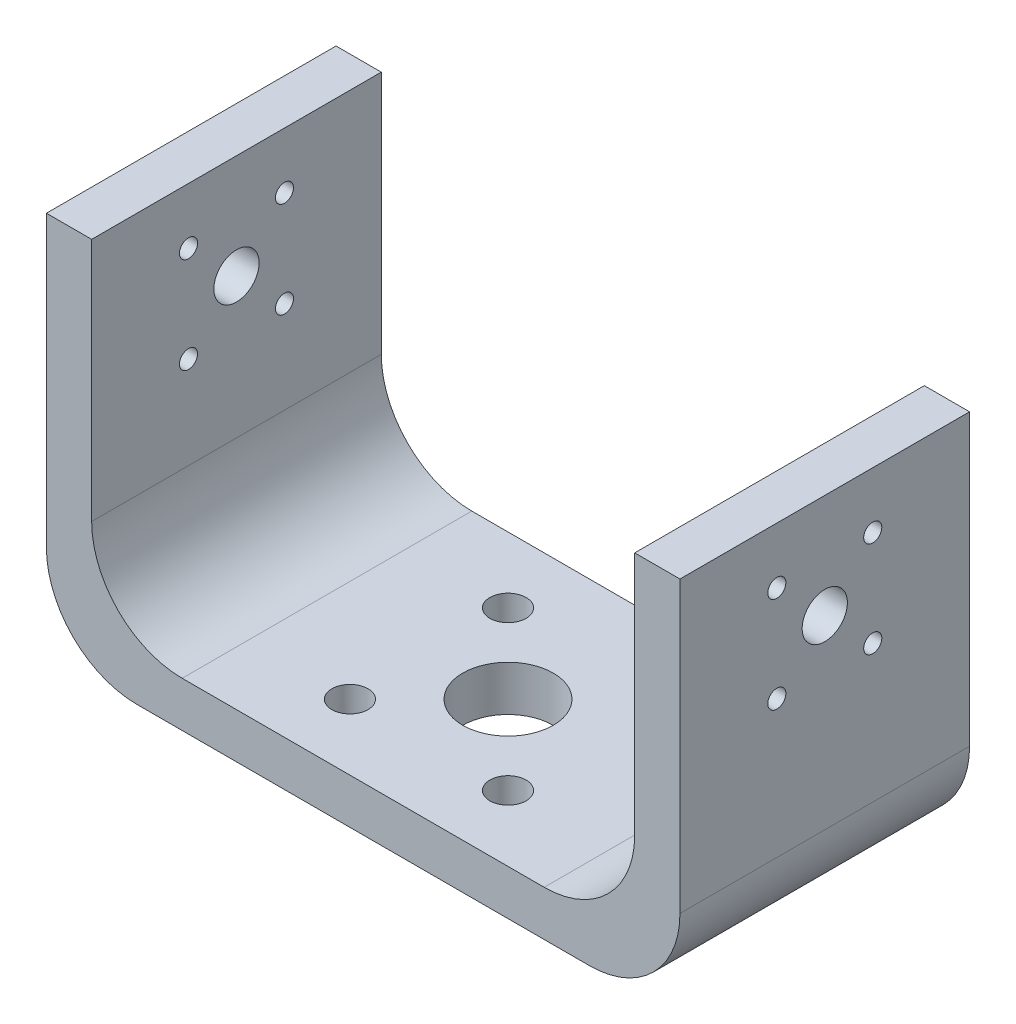
from build123d import *

# Parameters (mm, degrees)
SKETCH1_W           = 70
SKETCH1_H           = 32
BOSS_EXTRUDE1_DEPTH = 5
SKETCH2_W           = 5
SKETCH2_H           = 32
BOSS_EXTRUDE2_DEPTH = 37
SKETCH3_R           = 5
SKETCH3_R_2         = 2
CUT_EXTRUDE1_DEPTH  = 10
SKETCH4_R           = 2.5
CUT_EXTRUDE2_DEPTH  = 88.681240867
FILLET1_R           = 10
SKETCH6_R           = 1
CUT_EXTRUDE3_DEPTH  = 88.681240867


with BuildPart() as part:
    # Sketch1 → Boss-Extrude1 (new body)
    with BuildSketch(Plane(origin=(0, 0, 0), x_dir=(1, 0, 0), z_dir=(0, 1, 0))):
        with Locations((0, -16)):
            Rectangle(SKETCH1_W, SKETCH1_H)
    extrude(amount=BOSS_EXTRUDE1_DEPTH)

    # Sketch2 → Boss-Extrude2 (add)
    with BuildSketch(Plane(origin=(0, 5, 0), x_dir=(1, 0, 0), z_dir=(0, 1, 0))):
        with Locations((-32.5, -16)):
            Rectangle(SKETCH2_W, SKETCH2_H)
        with Locations((32.5, -16)):
            Rectangle(SKETCH2_W, SKETCH2_H)
    extrude(amount=BOSS_EXTRUDE2_DEPTH)

    # Sketch3 → Cut-Extrude1 (cut)
    with BuildSketch(Plane.XZ):
        with Locations((0, 16)):
            Circle(SKETCH3_R)
        with Locations((-8.732768748, 7.267231252)):
            Circle(SKETCH3_R_2)
        with Locations((-8.732768748, 24.732768748)):
            Circle(SKETCH3_R_2)
        with Locations((8.732768748, 24.732768748)):
            Circle(SKETCH3_R_2)
        with Locations((8.732768748, 7.267231252)):
            Circle(SKETCH3_R_2)
    extrude(amount=-CUT_EXTRUDE1_DEPTH, mode=Mode.SUBTRACT)

    # Sketch4 → Cut-Extrude2 (cut, through all)
    with BuildSketch(Plane.ZY.offset(35)):
        with Locations((16, 30.5)):
            Circle(SKETCH4_R)
    extrude(amount=-CUT_EXTRUDE2_DEPTH, mode=Mode.SUBTRACT)

    # Fillet1
    fillet1_edges = [part.edges().sort_by_distance(p)[0] for p in [
        (-35, 0, 16),
        (-30, 5, 16),
        (30, 5, 16),
        (35, 0, 16),
    ]]
    fillet(fillet1_edges, radius=FILLET1_R)

    # Sketch6 → Cut-Extrude3 (cut, through all)
    with BuildSketch(Plane.ZY.offset(35)):
        with Locations((21.3, 25.2)):
            Circle(SKETCH6_R)
        with Locations((10.7, 25.2)):
            Circle(SKETCH6_R)
        with Locations((10.7, 35.8)):
            Circle(SKETCH6_R)
        with Locations((21.3, 35.8)):
            Circle(SKETCH6_R)
    extrude(amount=-CUT_EXTRUDE3_DEPTH, mode=Mode.SUBTRACT)


solid = part.part
